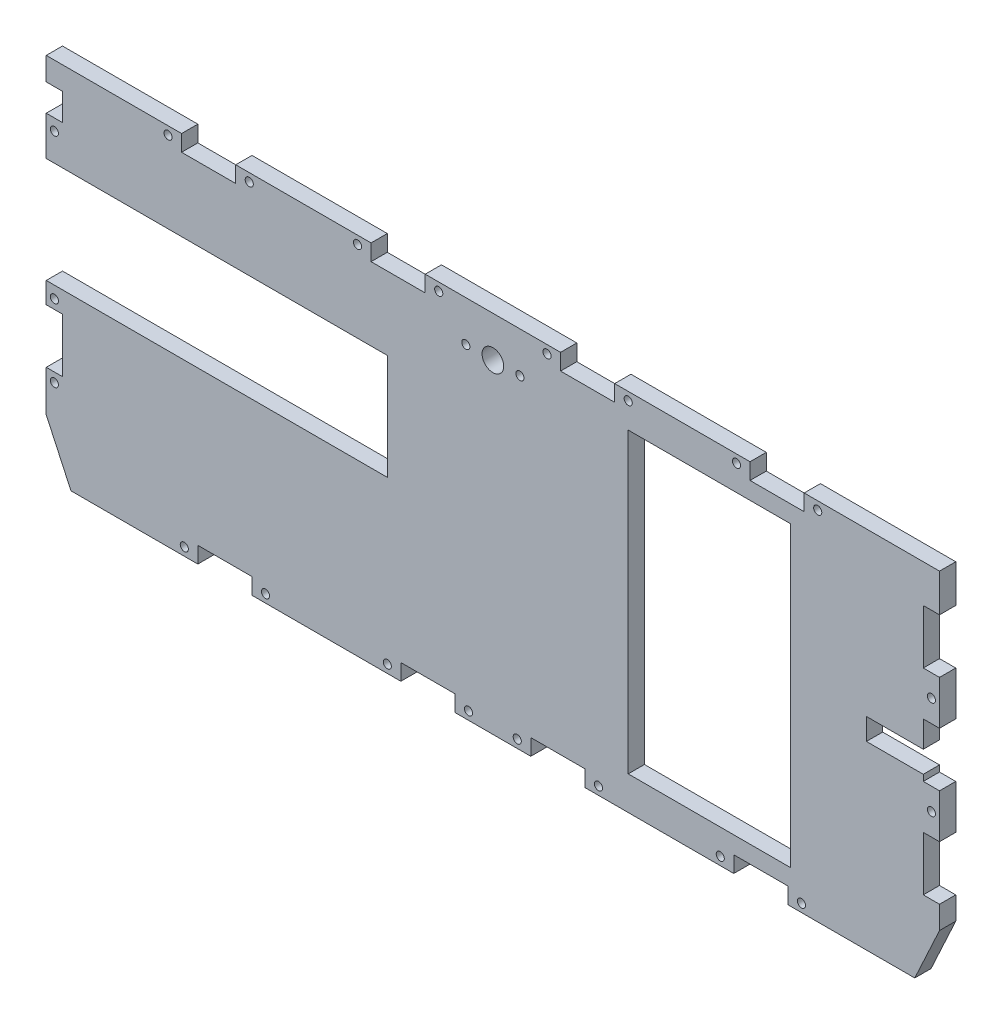
from build123d import *

# Parameters (mm, degrees)
BOSS_EXTRU_1_DEPTH      = 6
ESQUISSE3_W             = 6
ESQUISSE3_H             = 20
ESQUISSE3_H_2           = 10
ESQUISSE3_W_2           = 20
ESQUISSE3_H_3           = 6
ESQUISSE3_W_3           = 60
ESQUISSE3_H_4           = 110
ESQUISSE3_W_4           = 126
ESQUISSE3_H_5           = 39
ENL_V_MAT_EXTRU_2_DEPTH = 6
ESQUISSE4_R             = 1.5
ESQUISSE4_R_2           = 4
ENL_V_MAT_EXTRU_3_DEPTH = 6
ESQUISSE5_W             = 456.045253014
ESQUISSE5_H             = 136.228984631
ENL_V_MAT_EXTRU_4_DEPTH = 6
ESQUISSE6_W             = 21
ESQUISSE6_H             = 8
ENL_V_MAT_EXTRU_5_DEPTH = 10


with BuildPart() as part:
    # Esquisse1 → Boss.-Extru.1 (new body)
    with BuildSketch(Plane.XY):
        Polygon((-165, 96.73), (165, 96.73), (165, -18.27), (123, -109.022410436), (-123, -109.022410436), (-165, -18.27), align=None)
    extrude(amount=BOSS_EXTRU_1_DEPTH)

    # Esquisse3 → Enlèv. mat.-Extru.2 (cut)
    with BuildSketch(Plane(origin=(0, 0, 0), x_dir=(-1, 0, 0), z_dir=(0, 0, -1))):
        with Locations((162, 6.94)):
            Rectangle(ESQUISSE3_W, ESQUISSE3_H)
        with Locations((162, 83.23258956)):
            Rectangle(ESQUISSE3_W, ESQUISSE3_H_2)
        with Locations((-24, -35.02)):
            Rectangle(ESQUISSE3_W_2, ESQUISSE3_H_3)
        with Locations((99, -35.02)):
            Rectangle(ESQUISSE3_W_2, ESQUISSE3_H_3)
        with Locations((-80, 29.355)):
            Rectangle(ESQUISSE3_W_3, ESQUISSE3_H_4)
        with Locations((-162, 72.73)):
            Rectangle(ESQUISSE3_W, ESQUISSE3_H)
        with Locations((24, -35.02)):
            Rectangle(ESQUISSE3_W_2, ESQUISSE3_H_3)
        with Locations((-162, 36.44)):
            Rectangle(ESQUISSE3_W, ESQUISSE3_H)
        with Locations((-162, 0.15)):
            Rectangle(ESQUISSE3_W, ESQUISSE3_H)
        with Locations((105, 93.73)):
            Rectangle(ESQUISSE3_W_2, ESQUISSE3_H_3)
        with Locations((-35, 93.73)):
            Rectangle(ESQUISSE3_W_2, ESQUISSE3_H_3)
        with Locations((35, 93.73)):
            Rectangle(ESQUISSE3_W_2, ESQUISSE3_H_3)
        with Locations((-105, 93.73)):
            Rectangle(ESQUISSE3_W_2, ESQUISSE3_H_3)
        with Locations((102, 44.23)):
            Rectangle(ESQUISSE3_W_4, ESQUISSE3_H_5)
        with Locations((-99, -35.02)):
            Rectangle(ESQUISSE3_W_2, ESQUISSE3_H_3)
    extrude(amount=-ENL_V_MAT_EXTRU_2_DEPTH, mode=Mode.SUBTRACT)

    # Esquisse4 → Enlèv. mat.-Extru.3 (cut)
    with BuildSketch(Plane(origin=(0, 0, 0), x_dir=(-1, 0, 0), z_dir=(0, 0, -1))):
        with Locations((162, 20.335)):
            Circle(ESQUISSE4_R)
        with Locations((114, -35.02)):
            Circle(ESQUISSE4_R)
        with Locations((162, 73.98258956)):
            Circle(ESQUISSE4_R)
        with Locations((84, -35.02)):
            Circle(ESQUISSE4_R)
        with Locations((39, -35.02)):
            Circle(ESQUISSE4_R)
        with Locations((162, -6.46)):
            Circle(ESQUISSE4_R)
        with Locations((9, -35.02)):
            Circle(ESQUISSE4_R)
        with Locations((-9, -35.02)):
            Circle(ESQUISSE4_R)
        with Locations((-39, -35.02)):
            Circle(ESQUISSE4_R)
        with Locations((-84, -35.02)):
            Circle(ESQUISSE4_R)
        with Locations((120, 93.73)):
            Circle(ESQUISSE4_R)
        with Locations((-114, -35.02)):
            Circle(ESQUISSE4_R)
        with Locations((90, 93.73)):
            Circle(ESQUISSE4_R)
        with Locations((0, 81.73)):
            Circle(ESQUISSE4_R_2)
        with Locations((50, 93.73)):
            Circle(ESQUISSE4_R)
        with Locations((20, 93.73)):
            Circle(ESQUISSE4_R)
        with Locations((-162, 18.29)):
            Circle(ESQUISSE4_R)
        with Locations((-162, 54.585)):
            Circle(ESQUISSE4_R)
        with Locations((-20, 93.73)):
            Circle(ESQUISSE4_R)
        with Locations((-50, 93.73)):
            Circle(ESQUISSE4_R)
        with Locations((-90, 93.73)):
            Circle(ESQUISSE4_R)
        with Locations((-120, 93.73)):
            Circle(ESQUISSE4_R)
        with Locations((-10, 81.73)):
            Circle(ESQUISSE4_R)
        with Locations((10, 81.73)):
            Circle(ESQUISSE4_R)
    extrude(amount=-ENL_V_MAT_EXTRU_3_DEPTH, mode=Mode.SUBTRACT)

    # Esquisse5 → Enlèv. mat.-Extru.4 (cut)
    with BuildSketch(Plane(origin=(0, 0, 0), x_dir=(-1, 0, 0), z_dir=(0, 0, -1))):
        with Locations((-18.307092018, -106.134492316)):
            Rectangle(ESQUISSE5_W, ESQUISSE5_H)
    extrude(amount=-ENL_V_MAT_EXTRU_4_DEPTH, mode=Mode.SUBTRACT)

    # Esquisse6 → Enlèv. mat.-Extru.5 (cut)
    with BuildSketch(Plane(origin=(0, 0, 0), x_dir=(-1, 0, 0), z_dir=(0, 0, -1))):
        with Locations((-148.5, 32.73)):
            Rectangle(ESQUISSE6_W, ESQUISSE6_H)
    extrude(amount=-ENL_V_MAT_EXTRU_5_DEPTH, mode=Mode.SUBTRACT)


solid = part.part
